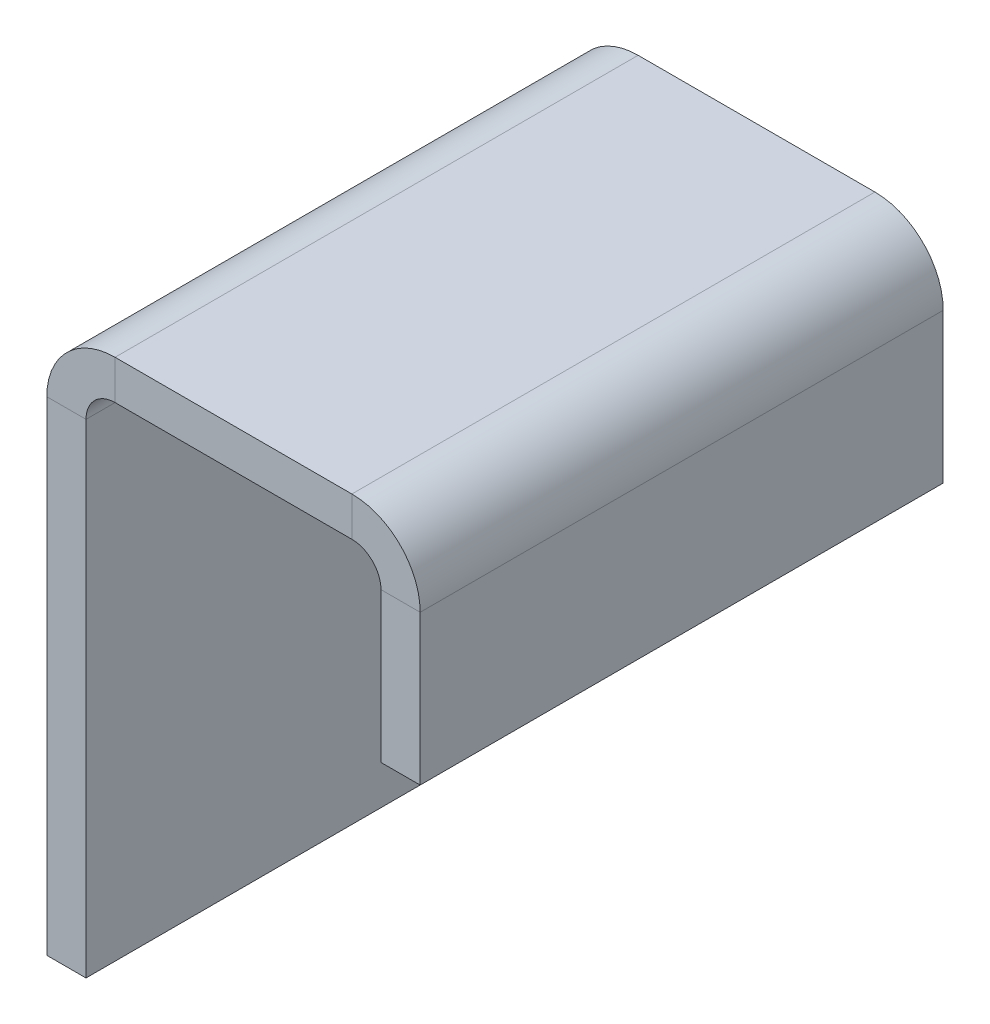
from build123d import *

# Parameters (mm, degrees)
BASE_FLANGE1_DEPTH = 36


# Sheet-metal steps are written as plain solids
with BuildPart() as part:
    # Sketch1 → Base-Flange1 (new body)
    with BuildSketch(Plane.XY):
        with BuildLine():
            Line((0, 0), (0, 33.3))
            ThreePointArc((0, 33.3), (1.376598128, 36.623401872), (4.7, 38))
            Line((4.7, 38), (21, 38))
            ThreePointArc((21, 38), (24.323401872, 36.623401872), (25.7, 33.3))
            Line((25.7, 33.3), (25.7, 23))
            Line((25.7, 23), (23, 23))
            Line((23, 23), (23, 33.3))
            ThreePointArc((23, 33.3), (22.414213562, 34.714213562), (21, 35.3))
            Line((21, 35.3), (4.7, 35.3))
            ThreePointArc((4.7, 35.3), (3.285786438, 34.714213562), (2.7, 33.3))
            Line((2.7, 33.3), (2.7, 0))
            Line((2.7, 0), (0, 0))
        make_face()
    extrude(amount=BASE_FLANGE1_DEPTH)


solid = part.part
